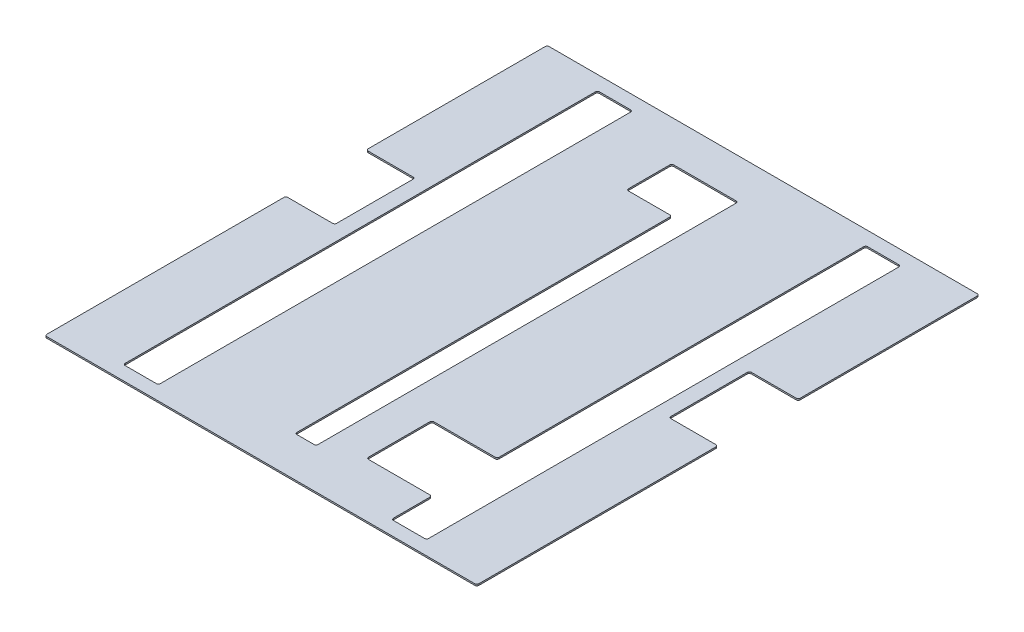
from build123d import *

# Parameters (mm, degrees)
SKETCH1_W           = 430
SKETCH1_H           = 500
BOSS_EXTRUDE1_DEPTH = 1.5
SKETCH2_W           = 48.6
SKETCH2_H           = 80
CUT_EXTRUDE1_DEPTH  = 10
SKETCH3_W           = 35
SKETCH3_H           = 472
CUT_EXTRUDE2_DEPTH  = 10
SKETCH4_W           = 65
SKETCH4_H           = 65
CUT_EXTRUDE3_DEPTH  = 10
FILLET2_R           = 2
FILLET3_R           = 2


with BuildPart() as part:
    # Sketch1 → Boss-Extrude1 (new body)
    with BuildSketch(Plane(origin=(0, 0, 0), x_dir=(1, 0, 0), z_dir=(0, 1, 0))):
        with Locations((6126.084066999, -8702.312377786)):
            Rectangle(SKETCH1_W, SKETCH1_H)
    extrude(amount=BOSS_EXTRUDE1_DEPTH)

    # Sketch2 → Cut-Extrude1 (cut)
    with BuildSketch(Plane(origin=(0, 1.5, 0), x_dir=(1, 0, 0), z_dir=(0, 1, 0))):
        with Locations((5935.384066999, -8672.447976714)):
            Rectangle(SKETCH2_W, SKETCH2_H)
        with Locations((6316.784066999, -8672.447976714)):
            Rectangle(SKETCH2_W, SKETCH2_H)
    extrude(amount=-CUT_EXTRUDE1_DEPTH, mode=Mode.SUBTRACT)

    # Sketch3 → Cut-Extrude2 (cut)
    with BuildSketch(Plane(origin=(0, 1.5, 0), x_dir=(1, 0, 0), z_dir=(0, 1, 0))):
        Polygon((5975.084066999, -8541.651929061), (5975.084066999, -8938.312377786), (6010.084066999, -8938.312377786), (6010.084066999, -8466.312377786), (5975.084066999, -8466.312377786), align=None)
        with Locations((6259.584066999, -8702.312377786)):
            Rectangle(SKETCH3_W, SKETCH3_H)
        Polygon((6111.084066999, -8492.312377786), (6141.084066999, -8492.312377786), (6141.084066999, -8912.312377786), (6120.084066999, -8912.312377786), (6120.084066999, -8537.312377786), (6075.084066999, -8537.312377786), (6075.084066999, -8492.312377786), align=None)
    extrude(amount=-CUT_EXTRUDE2_DEPTH, mode=Mode.SUBTRACT)

    # Sketch4 → Cut-Extrude3 (cut)
    with BuildSketch(Plane(origin=(0, 1.5, 0), x_dir=(1, 0, 0), z_dir=(0, 1, 0))):
        with Locations((6209.584066999, -8865.596518708)):
            Rectangle(SKETCH4_W, SKETCH4_H)
    extrude(amount=-CUT_EXTRUDE3_DEPTH, mode=Mode.SUBTRACT)

    # Fillet2
    fillet2_edges = [part.edges().sort_by_distance(p)[0] for p in [
        (6292.484066999, 0.75, 8632.447976714),
        (6341.084066999, 0.75, 8632.447976714),
        (6341.084066999, 0.75, 8712.447976714),
        (6292.484066999, 0.75, 8712.447976714),
        (5959.684066999, 0.75, 8632.447976714),
        (5959.684066999, 0.75, 8712.447976714),
        (5911.084066999, 0.75, 8712.447976714),
        (5911.084066999, 0.75, 8632.447976714),
        (5911.084066999, 0.75, 8452.312377786),
        (6341.084066999, 0.75, 8452.312377786),
        (6341.084066999, 0.75, 8952.312377786),
        (5911.084066999, 0.75, 8952.312377786),
    ]]
    fillet(fillet2_edges, radius=FILLET2_R)

    # Fillet3
    fillet3_edges = [part.edges().sort_by_distance(p)[0] for p in [
        (6010.084066999, 0.75, 8938.312377786),
        (5975.084066999, 0.75, 8938.312377786),
        (6010.084066999, 0.75, 8466.312377786),
        (5975.084066999, 0.75, 8466.312377786),
        (6277.084066999, 0.75, 8938.312377786),
        (6242.084066999, 0.75, 8938.312377786),
        (6277.084066999, 0.75, 8466.312377786),
        (6242.084066999, 0.75, 8466.312377786),
        (6141.084066999, 0.75, 8912.312377786),
        (6120.084066999, 0.75, 8912.312377786),
        (6141.084066999, 0.75, 8492.312377786),
        (6120.084066999, 0.75, 8537.312377786),
        (6075.084066999, 0.75, 8492.312377786),
        (6075.084066999, 0.75, 8537.312377786),
        (6242.084066999, 0.75, 8898.096518708),
        (6242.084066999, 0.75, 8833.096518708),
        (6177.084066999, 0.75, 8833.096518708),
        (6177.084066999, 0.75, 8898.096518708),
    ]]
    fillet(fillet3_edges, radius=FILLET3_R)


solid = part.part
